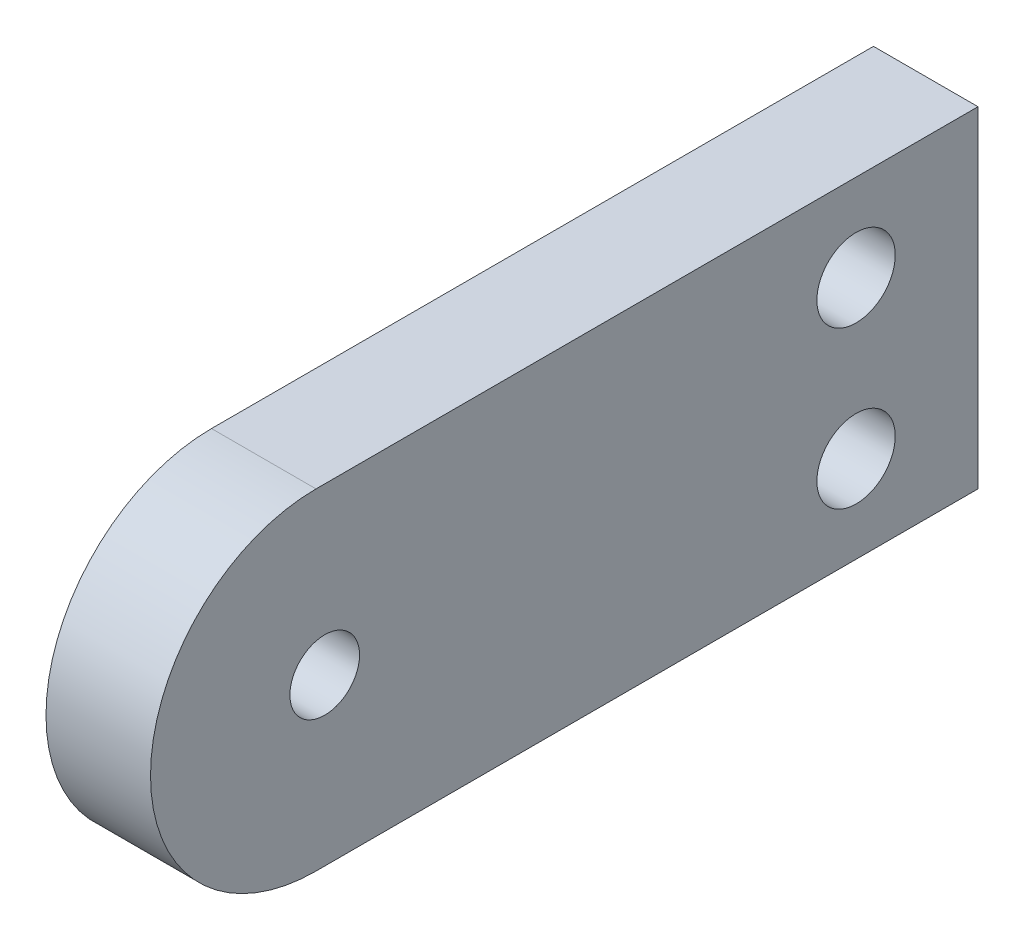
from build123d import *

# Parameters (mm, degrees)
SKETCH_1_W            = 250
SKETCH_1_H            = 29
SKETCH_1_W_2          = 30
SKETCH_1_H_2          = 15
EXTRUDE_1_DEPTH       = 28
SKETCH_1_3_R          = 2
CUT_EXTRUDE_1_DEPTH   = 132.450561049
CUT_EXTRUDE_START     = 2
SKETCH_1_5_R          = 2
CUT_EXTRUDE_2_DEPTH   = 24
SKETCH_3_W            = 6
SKETCH_3_H            = 19
EXTRUDE_2_DEPTH       = 35
SKETCH_3_3_W          = 6
SKETCH_3_3_H          = 19
EXTRUDE_3_DEPTH       = 35
SKETCH_1_6_R          = 2
CUT_EXTRUDE_3_DEPTH   = 166.088612569
CUT_EXTRUDE_7_REACH   = 167.089
SKETCH_1_8_R          = 3.1
FILLET_1_R            = 9.5
FILLET_2_R            = 5
SKETCH_4_R            = 5.1
CUT_EXTRUDE_4_DEPTH   = 31.5
SKETCH_4_2_OUTSIDE_W  = 87.946
SKETCH_4_2_OUTSIDE_H  = 103.946
SKETCH_4_2_OUTSIDE_R  = 5.1
CUT_EXTRUDE_5_DEPTH   = 21.5
SKETCH_5_OUTSIDE_W    = 83.722
SKETCH_5_OUTSIDE_H    = 99.722
SKETCH_5_OUTSIDE_W_2  = 23.8
SKETCH_5_OUTSIDE_H_2  = 24.8
CUT_EXTRUDE_6_DEPTH   = 18
SKETCH_6_R            = 0.75
CUT_EXTRUDE_8_DEPTH   = 4
SKETCH_7_R            = 0.75
CUT_EXTRUDE_9_DEPTH   = 4
SKETCH_8_R            = 0.75
CUT_EXTRUDE_10_DEPTH  = 4
SKETCH_9_R            = 0.75
CUT_EXTRUDE_11_DEPTH  = 4
SKETCH_11_R           = 0.75
CUT_EXTRUDE_12_DEPTH  = 166.088612569
SKETCH_10_R           = 2
CUT_EXTRUDE_14_DEPTH  = 166.088612569
SKETCH_10_5_R         = 0.75
CUT_EXTRUDE_15_DEPTH  = 4.1
CUT_EXTRUDE_START_2   = -23.9
SKETCH_10_6_R         = 0.75
CUT_EXTRUDE_16_DEPTH  = 4.1
SKETCH_13_W           = 19.8
SKETCH_13_H           = 40
CUT_EXTRUDE_17_DEPTH  = 4.1
SKETCH_14_W           = 19.8
SKETCH_14_H           = 10
CUT_EXTRUDE_18_DEPTH  = 4.1
CUT_EXTRUDE_19_DEPTH  = 166.088612569
SKETCH_16_W           = 16
SKETCH_16_H           = 2.5
SKETCH_16_H_2         = 12.5
CUT_EXTRUDE_20_DEPTH  = 3
SKETCH_18_OUTSIDE_W   = 207.564
SKETCH_18_OUTSIDE_H   = 81.564
SKETCH_18_OUTSIDE_W_2 = 47.5
SKETCH_18_OUTSIDE_H_2 = 19
CUT_EXTRUDE_21_DEPTH  = 166.088612569
CUT_EXTRUDE_START_3   = -6
SKETCH_18_4_W         = 47.5
SKETCH_18_4_H         = 19
CUT_EXTRUDE_22_DEPTH  = 157.709096242
SKETCH_18_5_R         = 1.5
CUT_EXTRUDE_23_DEPTH  = 161.394046024
SKETCH_18_6_R         = 2.25
CUT_EXTRUDE_24_DEPTH  = 4


with BuildPart() as part:
    # 草图1 → 凸台-拉伸1 (new body)
    with BuildSketch(Plane(origin=(0, 0, 0), x_dir=(0, 0, -1), z_dir=(1, 0, 0))):
        Rectangle(SKETCH_1_W, SKETCH_1_H)
        with Locations((-60, 22)):
            Rectangle(SKETCH_1_W_2, SKETCH_1_H_2)
        with Locations((0, 22)):
            Rectangle(SKETCH_1_W_2, SKETCH_1_H_2)
        with Locations((60, 22)):
            Rectangle(SKETCH_1_W_2, SKETCH_1_H_2)
    extrude(amount=EXTRUDE_1_DEPTH)

    # 草图1<3> → 切除-拉伸1 (cut, through all)
    with BuildSketch(Plane(origin=(0, 0, 0), x_dir=(0, 0, -1), z_dir=(1, 0, 0))):
        with Locations((-67.5, -10.858617882)):
            Circle(SKETCH_1_3_R)
        with Locations((-22.5, -10.858617882)):
            Circle(SKETCH_1_3_R)
        with Locations((22.5, -10.858617882)):
            Circle(SKETCH_1_3_R)
        with Locations((-60, 25.5)):
            Circle(SKETCH_1_3_R)
        with Locations((67.5, -10.858617882)):
            Circle(SKETCH_1_3_R)
        with Locations((0, 25.5)):
            Circle(SKETCH_1_3_R)
        with Locations((60, 25.5)):
            Circle(SKETCH_1_3_R)
    extrude(amount=CUT_EXTRUDE_1_DEPTH, mode=Mode.SUBTRACT)

    # 草图1<5> → 切除-拉伸2 (cut)
    # profile 1 of 7: a face of its own
    with BuildSketch(Plane(origin=(0, 0, 0), x_dir=(0, 0, -1), z_dir=(1, 0, 0)).offset(CUT_EXTRUDE_START)):
        with BuildLine():
            Line((-72.5, 29.5), (-72.5, 25.5))
            ThreePointArc((-72.5, 25.5), (-60, 13), (-47.5, 25.5))
            Line((-47.5, 25.5), (-47.5, 29.5))
            Line((-47.5, 29.5), (-72.5, 29.5))
        make_face()
        with Locations((-60, 25.5)):
            Circle(SKETCH_1_5_R, mode=Mode.SUBTRACT)
    # profile 2 of 7: a face of its own
    with BuildSketch(Plane(origin=(0, 0, 0), x_dir=(0, 0, -1), z_dir=(1, 0, 0)).offset(CUT_EXTRUDE_START)):
        with BuildLine():
            Line((-79.457856675, -14.5), (-55.542143325, -14.5))
            ThreePointArc((-55.542143325, -14.5), (-67.5, 1.641382118), (-79.457856675, -14.5))
        make_face()
        with Locations((-67.5, -10.858617882)):
            Circle(SKETCH_1_5_R, mode=Mode.SUBTRACT)
    # profile 3 of 7: a face of its own
    with BuildSketch(Plane(origin=(0, 0, 0), x_dir=(0, 0, -1), z_dir=(1, 0, 0)).offset(CUT_EXTRUDE_START)):
        with BuildLine():
            Line((-34.457856675, -14.5), (-10.542143325, -14.5))
            ThreePointArc((-10.542143325, -14.5), (-22.5, 1.641382118), (-34.457856675, -14.5))
        make_face()
        with Locations((-22.5, -10.858617882)):
            Circle(SKETCH_1_5_R, mode=Mode.SUBTRACT)
    # profile 4 of 7: a face of its own
    with BuildSketch(Plane(origin=(0, 0, 0), x_dir=(0, 0, -1), z_dir=(1, 0, 0)).offset(CUT_EXTRUDE_START)):
        with BuildLine():
            ThreePointArc((-12.5, 25.5), (0, 13), (12.5, 25.5))
            Line((12.5, 25.5), (12.5, 29.5))
            Line((12.5, 29.5), (-12.5, 29.5))
            Line((-12.5, 29.5), (-12.5, 25.5))
        make_face()
        with Locations((0, 25.5)):
            Circle(SKETCH_1_5_R, mode=Mode.SUBTRACT)
    # profile 5 of 7: a face of its own
    with BuildSketch(Plane(origin=(0, 0, 0), x_dir=(0, 0, -1), z_dir=(1, 0, 0)).offset(CUT_EXTRUDE_START)):
        with BuildLine():
            Line((10.542143325, -14.5), (34.457856675, -14.5))
            ThreePointArc((34.457856675, -14.5), (22.5, 1.641382118), (10.542143325, -14.5))
        make_face()
        with Locations((22.5, -10.858617882)):
            Circle(SKETCH_1_5_R, mode=Mode.SUBTRACT)
    # profile 6 of 7: a face of its own
    with BuildSketch(Plane(origin=(0, 0, 0), x_dir=(0, 0, -1), z_dir=(1, 0, 0)).offset(CUT_EXTRUDE_START)):
        with BuildLine():
            Line((55.542143325, -14.5), (79.457856675, -14.5))
            ThreePointArc((79.457856675, -14.5), (67.5, 1.641382118), (55.542143325, -14.5))
        make_face()
        with Locations((67.5, -10.858617882)):
            Circle(SKETCH_1_5_R, mode=Mode.SUBTRACT)
    # profile 7 of 7: a face of its own
    with BuildSketch(Plane(origin=(0, 0, 0), x_dir=(0, 0, -1), z_dir=(1, 0, 0)).offset(CUT_EXTRUDE_START)):
        with BuildLine():
            ThreePointArc((47.5, 25.5), (60, 13), (72.5, 25.5))
            Line((72.5, 25.5), (72.5, 29.5))
            Line((72.5, 29.5), (47.5, 29.5))
            Line((47.5, 29.5), (47.5, 25.5))
        make_face()
        with Locations((60, 25.5)):
            Circle(SKETCH_1_5_R, mode=Mode.SUBTRACT)
    extrude(amount=CUT_EXTRUDE_2_DEPTH, mode=Mode.SUBTRACT)

    # 草图3 → 凸台-拉伸2 (add)
    with BuildSketch(Plane.XY.offset(125)):
        with Locations((25, 0)):
            Rectangle(SKETCH_3_W, SKETCH_3_H)
    extrude(amount=EXTRUDE_2_DEPTH)

    # 草图3<3> → 凸台-拉伸3 (add)
    with BuildSketch(Plane.XY.offset(125)):
        with Locations((25, 0)):
            Rectangle(SKETCH_3_3_W, SKETCH_3_3_H)
        with Locations((3, 0)):
            Rectangle(SKETCH_3_3_W, SKETCH_3_3_H)
    extrude(amount=EXTRUDE_3_DEPTH)

    # 草图1<6> → 切除-拉伸3 (cut, through all)
    with BuildSketch(Plane(origin=(0, 0, 0), x_dir=(0, 0, -1), z_dir=(1, 0, 0))):
        with Locations(Location((-150, 0, 0), (0, 0, 90))):
            Circle(SKETCH_1_6_R)
    extrude(amount=CUT_EXTRUDE_3_DEPTH, mode=Mode.SUBTRACT)

    # 草图1<8> → 切除-拉伸7 (cut, up to next)
    with BuildSketch(Plane(origin=(0, 0, 0), x_dir=(0, 0, -1), z_dir=(1, 0, 0)), mode=Mode.PRIVATE) as cut_extrude_7_sk1:
        with Locations(Location((-150, 0, 0), (0, 0, 180))):
            Circle(SKETCH_1_8_R)
    cut_extrude_7_tool1 = extrude(cut_extrude_7_sk1.sketch, amount=CUT_EXTRUDE_7_REACH, mode=Mode.PRIVATE) & part.part
    add(cut_extrude_7_tool1.solids().sort_by_distance((0, 0, 150))[0], mode=Mode.SUBTRACT)

    # 圆角1
    fillet_1_edges = [part.edges().sort_by_distance(p)[0] for p in [
        (25, 9.5, 160),
        (25, -9.5, 160),
        (3, -9.5, 160),
        (3, 9.5, 160),
    ]]
    fillet(fillet_1_edges, radius=FILLET_1_R - 0.0001)  # a hair under: the kernel refuses the full size

    # 圆角2
    fillet_2_edges = [part.edges().sort_by_distance(p)[0] for p in [
        (14, -14.5, 125),
        (14, 14.5, 125),
    ]]
    fillet(fillet_2_edges, radius=FILLET_2_R)

    # 草图4 → 切除-拉伸4 (cut)
    with BuildSketch(Plane(origin=(0, 0, -125), x_dir=(-1, 0, 0), z_dir=(0, 0, -1))):
        with Locations((-14, 0)):
            Circle(SKETCH_4_R)
    extrude(amount=-CUT_EXTRUDE_4_DEPTH, mode=Mode.SUBTRACT)

    # 草图4<2> outside → 切除-拉伸5 (cut)
    with BuildSketch(Plane(origin=(0, 0, -125), x_dir=(-1, 0, 0), z_dir=(0, 0, -1))):
        with Locations((-14, 7.5)):
            Rectangle(SKETCH_4_2_OUTSIDE_W, SKETCH_4_2_OUTSIDE_H)
        with Locations((-14, 0)):
            Circle(SKETCH_4_2_OUTSIDE_R, mode=Mode.SUBTRACT)
    extrude(amount=-CUT_EXTRUDE_5_DEPTH, mode=Mode.SUBTRACT)

    # 草图5 outside → 切除-拉伸6 (cut)
    with BuildSketch(Plane(origin=(0, 0, -103.5), x_dir=(-1, 0, 0), z_dir=(0, 0, -1))):
        with Locations((-14, 7.5)):
            Rectangle(SKETCH_5_OUTSIDE_W, SKETCH_5_OUTSIDE_H)
        with Locations((-14, 0)):
            Rectangle(SKETCH_5_OUTSIDE_W_2, SKETCH_5_OUTSIDE_H_2, mode=Mode.SUBTRACT)
    extrude(amount=-CUT_EXTRUDE_6_DEPTH, mode=Mode.SUBTRACT)

    # 草图6 → 切除-拉伸8 (cut)
    with BuildSketch(Plane(origin=(0, 14.5, 0), x_dir=(1, 0, 0), z_dir=(0, 1, 0))):
        with Locations(Location((7, 23.5, 0), (0, 0, 270))):
            Circle(SKETCH_6_R)
        with Locations(Location((21, 35.5, 0), (0, 0, 270))):
            Circle(SKETCH_6_R)
        with Locations(Location((7, -23.5, 0), (0, 0, 270))):
            Circle(SKETCH_6_R)
        with Locations(Location((21, -35.5, 0), (0, 0, 270))):
            Circle(SKETCH_6_R)
    extrude(amount=-CUT_EXTRUDE_8_DEPTH, mode=Mode.SUBTRACT)

    # 草图7 → 切除-拉伸9 (cut)
    with BuildSketch(Plane(origin=(0, 14.5, 0), x_dir=(1, 0, 0), z_dir=(0, 1, 0))):
        with Locations(Location((7, -89.5, 0), (0, 0, 270))):
            Circle(SKETCH_7_R)
        with Locations(Location((21.2, -110.5, 0), (0, 0, 270))):
            Circle(SKETCH_7_R)
    extrude(amount=-CUT_EXTRUDE_9_DEPTH, mode=Mode.SUBTRACT)

    # 草图8 → 切除-拉伸10 (cut)
    with BuildSketch(Plane.ZY):
        with Locations((47, 4)):
            Circle(SKETCH_8_R)
        with Locations((2.499047641, -1.5)):
            Circle(SKETCH_8_R)
    extrude(amount=-CUT_EXTRUDE_10_DEPTH, mode=Mode.SUBTRACT)

    # 草图9 → 切除-拉伸11 (cut)
    with BuildSketch(Plane(origin=(28, 0, 0), x_dir=(0, 0, -1), z_dir=(1, 0, 0))):
        with Locations((-107.5, -0.5)):
            Circle(SKETCH_9_R)
        with Locations((-92.5, -0.5)):
            Circle(SKETCH_9_R)
    extrude(amount=-CUT_EXTRUDE_11_DEPTH, mode=Mode.SUBTRACT)

    # 草图11 → 切除-拉伸12 (cut, through all)
    with BuildSketch(Plane(origin=(0, 0, 0), x_dir=(0, 0, -1), z_dir=(1, 0, 0))):
        with Locations((-14.530122053, 6.5)):
            Circle(SKETCH_11_R)
        with Locations((-1.081846191, -6.5)):
            Circle(SKETCH_11_R)
        with Locations((5.469877947, 6.5)):
            Circle(SKETCH_11_R)
    extrude(amount=CUT_EXTRUDE_12_DEPTH, mode=Mode.SUBTRACT)

    # 草图10 → 切除-拉伸14 (cut, through all)
    # profile 1 of 2: a face of its own
    with BuildSketch(Plane.ZY):
        Polygon((15, 14.5), (30, 14.5), (30, 45.542128626), (-140.458536671, 45.542128626), (-140.458536671, -65.636075395), (-10, -65.636075395), (-10, -14.5), (-85.5, -14.5), (-85.5, 14.5), (-75, 14.5), (-75, 29.5), (-45, 29.5), (-45, 14.5), (-15, 14.5), (-15, 29.5), (15, 29.5), align=None)
    # profile 2 of 2: a face of its own
    with BuildSketch(Plane.ZY):
        Polygon((-10, 14.5), (15, 14.5), (15, 29.5), (-15, 29.5), (-15, 14.5), (-45, 14.5), (-45, 29.5), (-75, 29.5), (-75, 14.5), (-85.5, 14.5), (-85.5, -14.5), (-10, -14.5), align=None)
        with Locations((-67.5, -10.858617882)):
            Circle(SKETCH_10_R, mode=Mode.SUBTRACT)
        with Locations((-22.5, -10.858617882)):
            Circle(SKETCH_10_R, mode=Mode.SUBTRACT)
        with Locations((-60, 25.5)):
            Circle(SKETCH_10_R, mode=Mode.SUBTRACT)
        with Locations((0, 25.5)):
            Circle(SKETCH_10_R, mode=Mode.SUBTRACT)
    extrude(amount=-CUT_EXTRUDE_14_DEPTH, mode=Mode.SUBTRACT)

    # 草图10<5> → 切除-拉伸15 (cut)
    with BuildSketch(Plane.ZY):
        Polygon((0, -14.5), (30, 14.5), (15, 14.5), (-10, 14.5), (-10, -14.5), align=None)
        with Locations((2.499047641, -1.5)):
            Circle(SKETCH_10_5_R, mode=Mode.SUBTRACT)
    extrude(amount=-CUT_EXTRUDE_15_DEPTH, mode=Mode.SUBTRACT)

    # 草图10<6> → 切除-拉伸16 (cut)
    # profile 1 of 2: a face of its own
    with BuildSketch(Plane.ZY.offset(CUT_EXTRUDE_START_2)):
        Polygon((0, -14.5), (30, 14.5), (15, 14.5), (-10, 14.5), (-10, -14.5), align=None)
        with Locations((2.499047641, -1.5)):
            Circle(SKETCH_10_6_R, mode=Mode.SUBTRACT)
    # profile 2 of 2: a face of its own
    with BuildSketch(Plane.ZY.offset(CUT_EXTRUDE_START_2)):
        with Locations((2.499047641, -1.5)):
            Circle(SKETCH_10_6_R)
    extrude(amount=-CUT_EXTRUDE_16_DEPTH, mode=Mode.SUBTRACT)

    # 草图13 → 切除-拉伸17 (cut)
    with BuildSketch(Plane(origin=(0, 14.5, 0), x_dir=(1, 0, 0), z_dir=(0, 1, 0))):
        with Locations((14, -10)):
            Rectangle(SKETCH_13_W, SKETCH_13_H)
    extrude(amount=-CUT_EXTRUDE_17_DEPTH, mode=Mode.SUBTRACT)

    # 草图14 → 切除-拉伸18 (cut)
    with BuildSketch(Plane.XZ.offset(14.5)):
        with Locations((14, -5)):
            Rectangle(SKETCH_14_W, SKETCH_14_H)
    extrude(amount=-CUT_EXTRUDE_18_DEPTH, mode=Mode.SUBTRACT)

    # 草图15 → 切除-拉伸19 (cut, through all)
    with BuildSketch(Plane.ZY):
        Polygon((0, -10.4), (0, -14.5), (4.24137931, -10.4), align=None)
    extrude(amount=-CUT_EXTRUDE_19_DEPTH, mode=Mode.SUBTRACT)

    # 草图16 → 切除-拉伸20 (cut)
    with BuildSketch(Plane(origin=(0, 29.5, 0), x_dir=(1, 0, 0), z_dir=(0, 1, 0))):
        with Locations((14, -76.25)):
            Rectangle(SKETCH_16_W, SKETCH_16_H)
        with Locations((14, -73.75)):
            Rectangle(SKETCH_16_W, SKETCH_16_H)
        with Locations((14, -66.25)):
            Rectangle(SKETCH_16_W, SKETCH_16_H_2)
    extrude(amount=-CUT_EXTRUDE_20_DEPTH, mode=Mode.SUBTRACT)

    # 草图18 outside → 切除-拉伸21 (cut, through all)
    with BuildSketch(Plane(origin=(28, 0, 0), x_dir=(0, 0, -1), z_dir=(1, 0, 0))):
        with Locations((-75, 7.5)):
            Rectangle(SKETCH_18_OUTSIDE_W, SKETCH_18_OUTSIDE_H)
        with Locations((-136.25, 0)):
            Rectangle(SKETCH_18_OUTSIDE_W_2, SKETCH_18_OUTSIDE_H_2, mode=Mode.SUBTRACT)
    extrude(amount=-CUT_EXTRUDE_21_DEPTH, mode=Mode.SUBTRACT)

    # 草图18<4> → 切除-拉伸22 (cut, through all)
    with BuildSketch(Plane(origin=(28, 0, 0), x_dir=(0, 0, -1), z_dir=(1, 0, 0)).offset(CUT_EXTRUDE_START_3)):
        with Locations((-136.25, 0)):
            Rectangle(SKETCH_18_4_W, SKETCH_18_4_H)
    extrude(amount=-CUT_EXTRUDE_22_DEPTH, mode=Mode.SUBTRACT)

    # 草图18<5> → 切除-拉伸23 (cut, through all)
    with BuildSketch(Plane(origin=(28, 0, 0), x_dir=(0, 0, -1), z_dir=(1, 0, 0))):
        with Locations((-119.5, 4.5)):
            Circle(SKETCH_18_5_R)
        with Locations((-119.5, -4.5)):
            Circle(SKETCH_18_5_R)
    extrude(amount=-CUT_EXTRUDE_23_DEPTH, mode=Mode.SUBTRACT)

    # 草图18<6> → 切除-拉伸24 (cut)
    with BuildSketch(Plane(origin=(28, 0, 0), x_dir=(0, 0, -1), z_dir=(1, 0, 0))):
        with Locations((-119.5, 4.5)):
            Circle(SKETCH_18_6_R)
        with Locations((-119.5, -4.5)):
            Circle(SKETCH_18_6_R)
    extrude(amount=-CUT_EXTRUDE_24_DEPTH, mode=Mode.SUBTRACT)


solid = part.part
